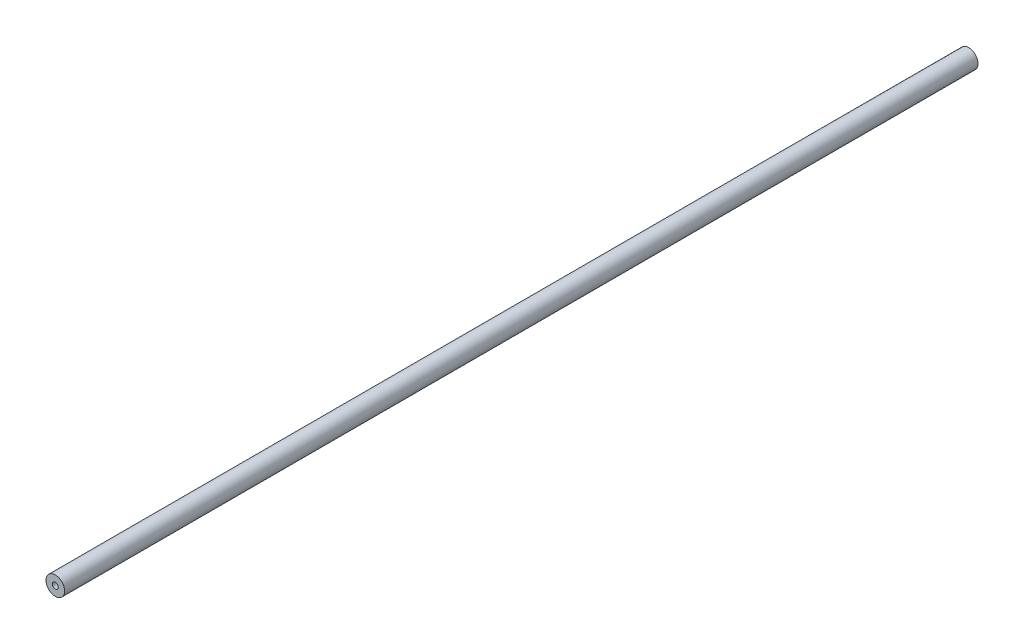
from build123d import *

# Parameters (mm, degrees)
SKETCH1_R                  = 6.35
BOSS_EXTRUDE1_DEPTH        = 622.554
F_10_32_TAPPED_HOLE1_D     = 4.0386
F_10_32_TAPPED_HOLE1_DEPTH = 13.716
F_10_32_TAPPED_HOLE1_TIP   = 1.213317848
F_10_32_TAPPED_HOLE2_D     = 4.0386
F_10_32_TAPPED_HOLE2_DEPTH = 13.716
F_10_32_TAPPED_HOLE2_TIP   = 1.213317848


with BuildPart() as part:
    # Sketch1 → Boss-Extrude1 (new body)
    with BuildSketch(Plane.XY):
        Circle(SKETCH1_R)
    extrude(amount=BOSS_EXTRUDE1_DEPTH)

    # #10-32 Tapped Hole1
    with Locations(Plane.XY.offset(622.554)):
        with Locations((0, 0)):
            Hole(F_10_32_TAPPED_HOLE1_D / 2, depth=F_10_32_TAPPED_HOLE1_DEPTH)
            with Locations((0, 0, -(F_10_32_TAPPED_HOLE1_DEPTH + F_10_32_TAPPED_HOLE1_TIP / 2))):  # 118° drill point
                Cone(0, F_10_32_TAPPED_HOLE1_D / 2, F_10_32_TAPPED_HOLE1_TIP, mode=Mode.SUBTRACT)

    # #10-32 Tapped Hole2
    with Locations(Plane(origin=(0, 0, 0), x_dir=(-1, 0, 0), z_dir=(0, 0, -1))):
        with Locations((0, 0)):
            Hole(F_10_32_TAPPED_HOLE2_D / 2, depth=F_10_32_TAPPED_HOLE2_DEPTH)
            with Locations((0, 0, -(F_10_32_TAPPED_HOLE2_DEPTH + F_10_32_TAPPED_HOLE2_TIP / 2))):  # 118° drill point
                Cone(0, F_10_32_TAPPED_HOLE2_D / 2, F_10_32_TAPPED_HOLE2_TIP, mode=Mode.SUBTRACT)


solid = part.part
